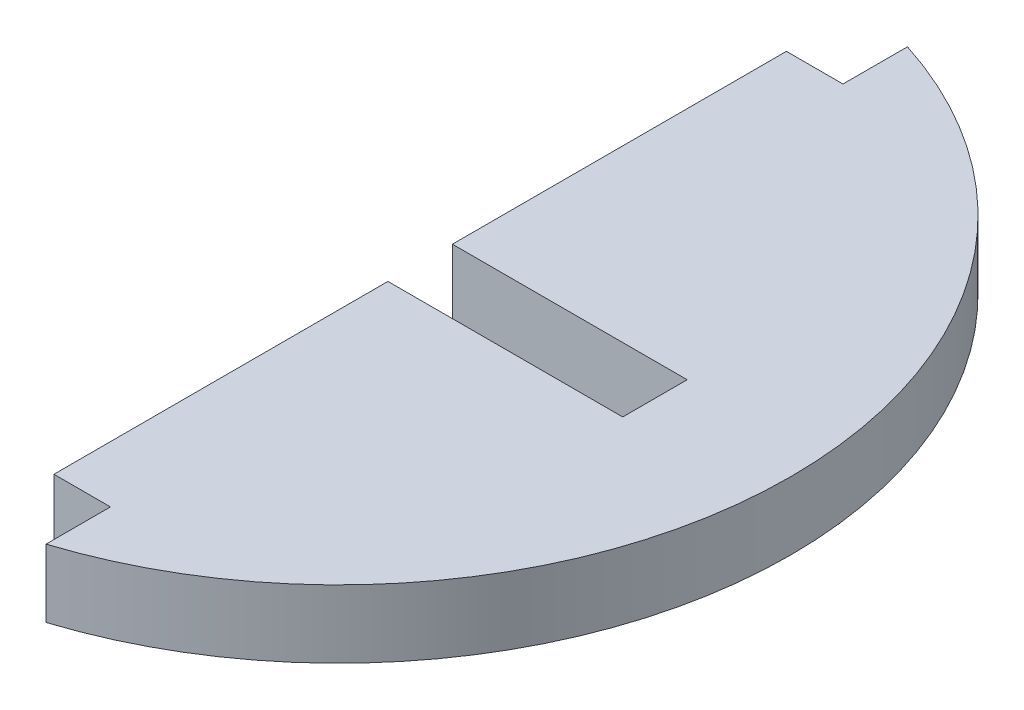
from build123d import *

# Parameters (mm, degrees)
BOSS_EXTRUDE1_DEPTH      = 1.5
BOSS_EXTRUDE1_DEPTH_BACK = 1.5


with BuildPart() as part:
    # Sketch1 → Boss-Extrude1 (new, two sides: drawn at the far end of the back side and taken through both)
    with BuildSketch(Plane(origin=(0, 0, 0), x_dir=(1, 0, 0), z_dir=(0, 1, 0)).offset(-BOSS_EXTRUDE1_DEPTH_BACK)):
        with BuildLine():
            Line((3.621320344, -1.425), (14, -1.425))
            Line((14, -1.425), (14, 1.425))
            Line((14, 1.425), (3.621320344, 1.425))
            Line((3.621320344, 1.425), (3.621320344, 16.190205809))
            Line((3.621320344, 16.190205809), (6.121320344, 16.190205809))
            Line((6.121320344, 16.190205809), (6.121320344, 19.040205809))
            ThreePointArc((6.121320344, 19.040205809), (20, 0), (6.121320344, -19.040205809))
            Line((6.121320344, -19.040205809), (6.121320344, -16.190205809))
            Line((6.121320344, -16.190205809), (3.621320344, -16.190205809))
            Line((3.621320344, -16.190205809), (3.621320344, -1.425))
        make_face()
    extrude(amount=BOSS_EXTRUDE1_DEPTH + BOSS_EXTRUDE1_DEPTH_BACK)


solid = part.part
